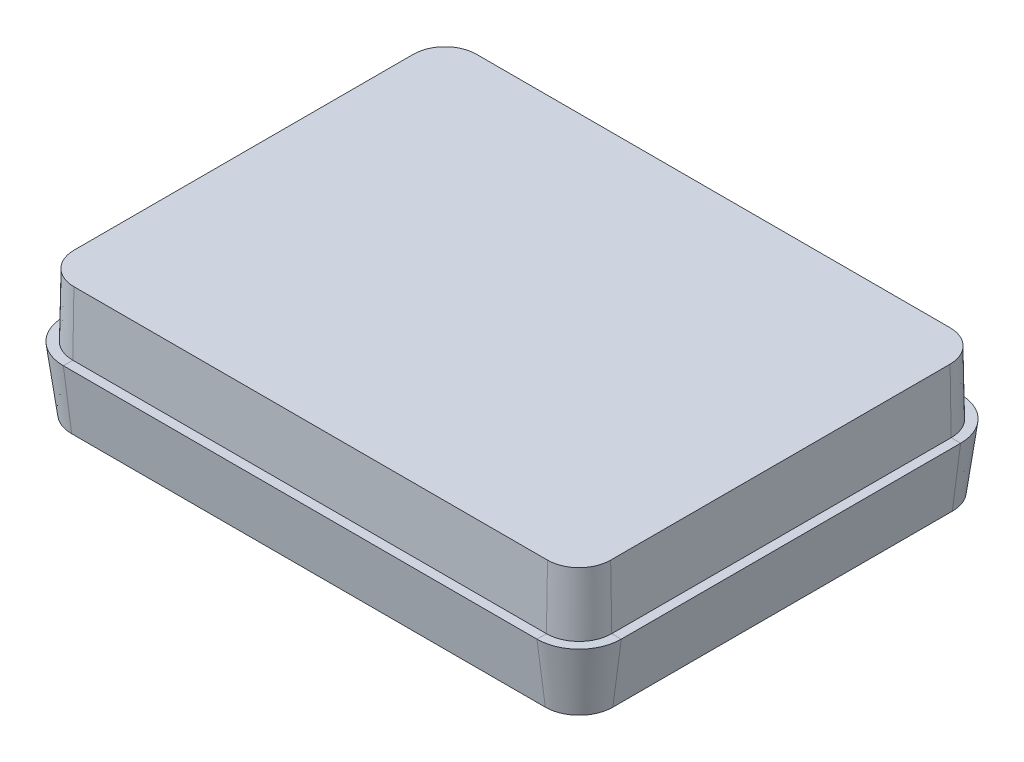
from build123d import *

# Parameters (mm, degrees)
BOSS_EXTRUDE1_DEPTH = 4
BOSS_EXTRUDE1_DRAFT = 1
SHELL1_T            = -0.5
SKETCH2_R           = 2
BOSS_EXTRUDE2_DEPTH = 5.5
BOSS_EXTRUDE2_TAPER = 1.5
CIRPATTERN1_COUNT   = 4
SKETCH4_R           = 1.605977431
CUT_EXTRUDE1_DEPTH  = 5.5
CUT_EXTRUDE1_DRAFT  = 1.5
RIB2_START          = -8.069744096
RIB2_DEPTH          = 6.231928651
RIB2_START_2        = 1.837815445
RIB2_2_DEPTH        = 6.231928651
RIB2_START_3        = -5.944744096
RIB2_3_DEPTH        = 4.106928651
RIB2_4_DEPTH        = 4.106928651


with BuildPart() as part:
    # Sketch1 → Boss-Extrude1 (with draft: the straight prism first)
    with BuildSketch(Plane(origin=(0, 0, 0), x_dir=(1, 0, 0), z_dir=(0, 1, 0))):
        with BuildLine():
            Line((-7.5, -6.375), (7.5, -6.375))
            ThreePointArc((7.5, -6.375), (8.207106781, -6.082106781), (8.5, -5.375))
            Line((8.5, -5.375), (8.5, 5.375))
            ThreePointArc((8.5, 5.375), (8.207106781, 6.082106781), (7.5, 6.375))
            Line((7.5, 6.375), (-7.5, 6.375))
            ThreePointArc((-7.5, 6.375), (-8.207106781, 6.082106781), (-8.5, 5.375))
            Line((-8.5, 5.375), (-8.5, -5.375))
            ThreePointArc((-8.5, -5.375), (-8.207106781, -6.082106781), (-7.5, -6.375))
        make_face()
    extrude(amount=-BOSS_EXTRUDE1_DEPTH)
    # Boss-Extrude1: the draft: its side faces are tilted about the plane it starts from
    boss_extrude1_sides = [part.faces().sort_by_distance(p)[0] for p in [
        (0, -2, 6.375),
        (8.207106781, -2, 6.082106781),
        (8.5, -2, 0),
        (8.207106781, -2, -6.082106781),
        (0, -2, -6.375),
        (-8.207106781, -2, -6.082106781),
        (-8.5, -2, 0),
        (-8.207106781, -2, 6.082106781),
    ]]
    draft(boss_extrude1_sides, Plane(origin=(0, 0, 0), x_dir=(1, 0, 0), z_dir=(0, 1, 0)), BOSS_EXTRUDE1_DRAFT)

    # Shell1
    shell1_openings = [part.faces().sort_by_distance(p)[0] for p in [
        (0, -4, 0),
    ]]
    offset(amount=SHELL1_T, openings=shell1_openings, kind=Kind.INTERSECTION)

    # Sketch2 → Boss-Extrude2 (add)
    with BuildSketch(Plane.XZ.offset(0.5)):
        Circle(SKETCH2_R)
    extrude(amount=BOSS_EXTRUDE2_DEPTH, taper=BOSS_EXTRUDE2_TAPER)

    # Rib1: read off the stored shape, not the designer's step
    # Rib1: loft between two sections, ruled curve by curve
    rib1_from = [
        Edge.make_line((-1.982384256, -0.5, 0.264863479), (-2.837165081, -0.5, 0.25)),
        Edge.make_line((-2.837165081, -0.5, -0.25), (-1.982384256, -0.5, -0.264863479)),
        Edge.make_line((-2.837165081, -0.5, -0.25), (-2.837165081, -0.5, 0.25)),
        Edge.make_line((-1.982384256, -0.5, -0.264863479), (-1.982384256, -0.5, 0.264863479)),
    ]
    rib1_to = [
        Edge.make_line((-1.837815545, -6, 0.259010132), (-2.355977431, -6, 0.25)),
        Edge.make_line((-2.355977431, -6, -0.25), (-1.837815545, -6, -0.259010132)),
        Edge.make_line((-2.355977431, -6, -0.25), (-2.355977431, -6, 0.25)),
        Edge.make_line((-1.837815545, -6, -0.259010132), (-1.837815545, -6, 0.259010132)),
    ]
    rib1 = Solid(Shell([*[Face.make_surface_from_curves(rib1_from[k], rib1_to[k]) for k in range(4)], Face(Wire(rib1_from)), Face(Wire(rib1_to))]))
    add(rib1)

    # CirPattern1: Rib1 ×4 about axis
    cirpattern1_axis = Axis((0, 0, 0), (0, 1, 0))
    for i in range(1, CIRPATTERN1_COUNT):
        add(rib1.rotate(cirpattern1_axis, i * 360 / CIRPATTERN1_COUNT))


with BuildPart() as cut_extrude1_tool:
    # Sketch4 → Cut-Extrude1 (with draft: the straight prism first)
    with BuildSketch(Plane.XZ.offset(6)):
        Circle(SKETCH4_R)
    extrude(amount=-CUT_EXTRUDE1_DEPTH)
    # Cut-Extrude1: the draft: its side faces are tilted about the plane it starts from
    cut_extrude1_sides = [cut_extrude1_tool.faces().sort_by_distance(p)[0] for p in [
        (-1.605977431, -3.25, 0),
    ]]
    draft(cut_extrude1_sides, Plane.XZ.offset(6), CUT_EXTRUDE1_DRAFT)


with BuildPart() as part_1:
    add(part.part)

    # Cut-Extrude1: cut by cut_extrude1_tool
    add(cut_extrude1_tool.part, mode=Mode.SUBTRACT)

    # Sweep1: sweep along a path in Sketch6
    with BuildLine(Plane(origin=(0, -2, 0), x_dir=(1, 0, 0), z_dir=(0, 1, 0))) as sweep1_path:
        Line((-8.56982026, 5.375), (-8.56982026, -5.375))
        ThreePointArc((-8.56982026, -5.375), (-8.25647716, -6.13147716), (-7.5, -6.44482026))
        Line((-7.5, -6.44482026), (7.5, -6.44482026))
        ThreePointArc((7.5, -6.44482026), (8.25647716, -6.13147716), (8.56982026, -5.375))
        Line((8.56982026, -5.375), (8.56982026, 5.375))
        ThreePointArc((8.56982026, 5.375), (8.25647716, 6.13147716), (7.5, 6.44482026))
        Line((7.5, 6.44482026), (-7.5, 6.44482026))
        ThreePointArc((-7.5, 6.44482026), (-8.25647716, 6.13147716), (-8.56982026, 5.375))
    # Sketch5 → Sweep1 (sweep)
    with BuildSketch(Plane(origin=(0, 0, 0), x_dir=(0, 0, -1), z_dir=(1, 0, 0))):
        Polygon((6.44482026, -4), (6.40991013, -2), (6.70991013, -2), align=None)
    sweep(path=sweep1_path.line)

    # Rib2: read off the stored shape, not the designer's step
    # Rib2 outline → Rib2 (add)
    with BuildSketch(Plane.YZ.offset(RIB2_START)):
        Polygon((-2, -0.25), (-0.5, -0.276182597), (-0.5, 0.276182597), (-2, 0.25), align=None)
    extrude(amount=RIB2_DEPTH)

    # Rib2 2 outline → Rib2 2 (add)
    with BuildSketch(Plane.YZ.offset(RIB2_START_2)):
        Polygon((-2, -0.25), (-0.5, -0.276182597), (-0.5, 0.276182597), (-2, 0.25), align=None)
    extrude(amount=RIB2_2_DEPTH)

    # Rib2 3 outline → Rib2 3 (add)
    with BuildSketch(Plane.XY.offset(RIB2_START_3)):
        Polygon((-0.276182597, -0.5), (-0.25, -2), (0.25, -2), (0.276182597, -0.5), align=None)
    extrude(amount=RIB2_3_DEPTH)

    # Rib2 4 outline → Rib2 4 (add)
    with BuildSketch(Plane.XY.offset(RIB2_START_2)):
        Polygon((-0.276182597, -0.5), (-0.25, -2), (0.25, -2), (0.276182597, -0.5), align=None)
    extrude(amount=RIB2_4_DEPTH)


solid = part_1.part
